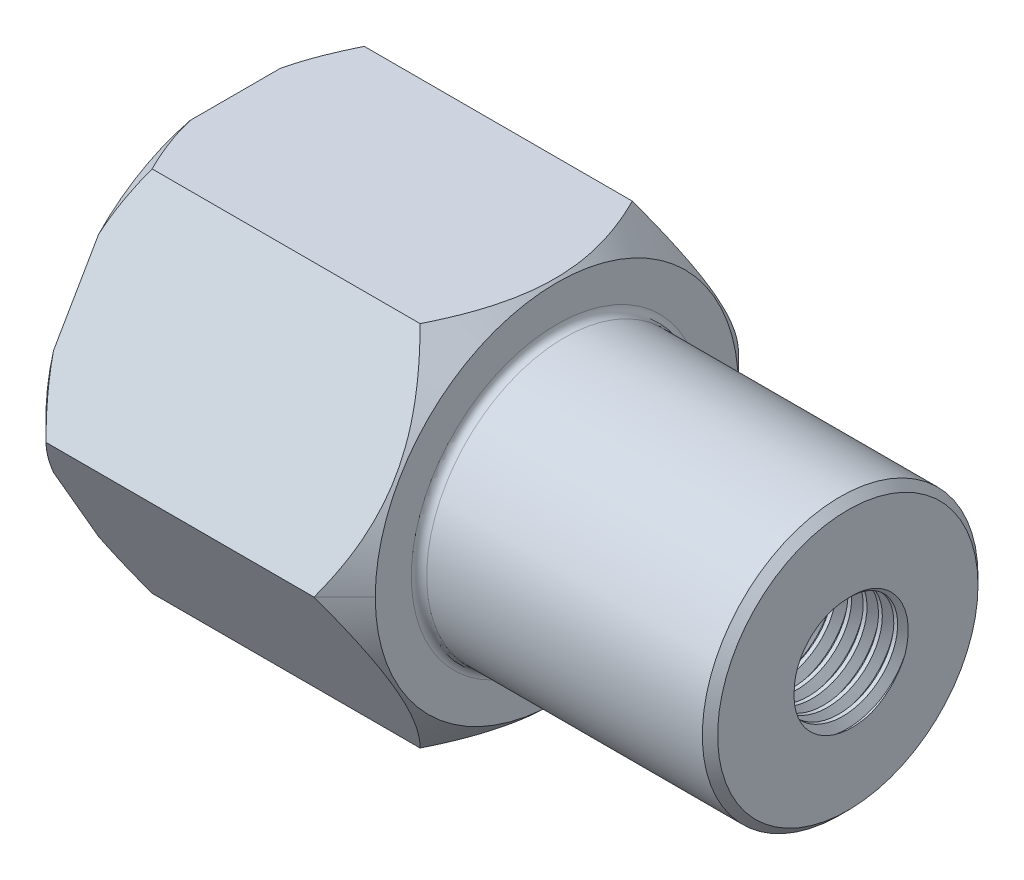
from build123d import *

# Parameters (mm, degrees)
SKETCH_1_R      = 8.5
EXTRUDE_1_DEPTH = 21
SKETCH_2_R      = 9
SKETCH_2_R_2    = 4.5
EXTRUDE_2_DEPTH = 10
THREAD_1_PITCH  = 1
FILLET_1_R      = 0.5
SKETCH_11_R     = 9
SKETCH_11_R_2   = 3.5
EXTRUDE_3_DEPTH = 9
CHAMFER_1_SIZE  = 0.5
THREAD_2_PITCH  = 1


with BuildPart() as part:
    # Sketch 1 → Бобышка-Вытянуть1 (new body)
    with BuildSketch(Plane(origin=(0, 0, 0), x_dir=(0, 0, -1), z_dir=(1, 0, 0))):
        Polygon((13.856406461, 0), (6.92820323, 12), (-6.92820323, 12), (-13.856406461, 0), (-6.92820323, -12), (6.92820323, -12), align=None)
        with Locations(Location((0, 0, 0), (0, 0, 180))):
            Circle(SKETCH_1_R, mode=Mode.SUBTRACT)
    extrude(amount=EXTRUDE_1_DEPTH)

    # Эскиз2 → Бобышка-Вытянуть2 (add)
    with BuildSketch(Plane(origin=(21, 0, 0), x_dir=(0, 0, -1), z_dir=(1, 0, 0))):
        Circle(SKETCH_2_R)
        Circle(SKETCH_2_R_2, mode=Mode.SUBTRACT)
    extrude(amount=EXTRUDE_2_DEPTH)

    # Резьба1: arcs per turn and ends read off the stored shape
    # Резьба1: the profile of Sketch 1 2 profile screwed along a right-hand helix through 14 turns, 8 arcs to a turn; built about Z, then put on its axis
    thread_1_z = Axis((0, 0, 0), (0, 0, 1))
    thread_1_corners = [(8.4997, 0, -0.000173205), (9.041265875, 0, 0.312499999), (9.041265875, 0, 0.437499999), (8.4997, 0, 0.750173202)]
    with BuildLine(mode=Mode.PRIVATE) as thread_1_profile:
        Line(thread_1_corners[0], thread_1_corners[1])
        Line(thread_1_corners[1], thread_1_corners[2])
        Line(thread_1_corners[2], thread_1_corners[3])
        Line(thread_1_corners[3], thread_1_corners[0])
    thread_1_cap = Face(thread_1_profile.wire())
    thread_1_turn_angles = [0, 22.5, 45, 67.5, 90, 112.5, 135, 157.5, 180, 202.5, 225, 247.5, 270, 292.5, 315, 337.5, 360]
    thread_1_turn_weights = [1, 0.9238795325112867, 1, 0.9238795325112867, 1, 0.9238795325112867, 1, 0.9238795325112867, 1, 0.9238795325112867, 1, 0.9238795325112867, 1, 0.9238795325112867, 1, 0.9238795325112867, 1]
    thread_1_turn_rails = [Edge.make_bspline([Vector(p[0], p[1], 0).rotate(thread_1_z, thread_1_turn_angles[k]) / thread_1_turn_weights[k] + Vector(0, 0, p[2] + THREAD_1_PITCH * thread_1_turn_angles[k] / 360) for k in range(17)], [0, 0, 0, 1, 1, 2, 2, 3, 3, 4, 4, 5, 5, 6, 6, 7, 7, 8, 8, 8], 2, thread_1_turn_weights) for p in thread_1_corners]
    thread_1_turn_sides = [Face.make_surface_from_curves(thread_1_turn_rails[p[0]], thread_1_turn_rails[p[1]]) for p in [(0, 1), (1, 2), (2, 3), (3, 0)]]
    thread_1 = Plane(origin=(-2, 0, 0), x_dir=(0, 0, -1), z_dir=(1, 0, 0)) * Solid(Shell([*[p.moved(Location((0, 0, THREAD_1_PITCH * i))) for i in range(14) for p in thread_1_turn_sides], thread_1_cap, thread_1_cap.rotate(thread_1_z, 5040).moved(Location((0, 0, THREAD_1_PITCH * 5040 / 360)))]))
    add(thread_1, mode=Mode.SUBTRACT)

    # Вырез-По траектории1: sweep along a curve in space
    with BuildLine() as sweep_1_path:
        ThreePointArc((21, 0, -9), (21, 6.363961031, -6.363961031), (21, 9, 0))
        ThreePointArc((21, 9, 0), (21, 6.363961031, 6.363961031), (21, 0, 9))
        ThreePointArc((21, 0, 9), (21, -6.363961031, 6.363961031), (21, -9, 0))
        ThreePointArc((21, -9, 0), (21, -6.363961031, -6.363961031), (21, 0, -9))
    # Эскиз8 → Вырез-По траектории1 (sweep, cut)
    with BuildSketch(Plane(origin=(0, 0, 0), x_dir=(1, 0, 0), z_dir=(0, 1, 0))):
        Polygon((21, -13.856406461), (19, -13.856406461), (21, -11.856406461), align=None)
    sweep(path=sweep_1_path.line, mode=Mode.SUBTRACT)

    # Вырез-По траектории4: sweep along a path in Эскиз10
    with BuildLine(Plane.ZY) as sweep_4_path:
        CenterArc((0, 0), 12, 0, 360)
    # Эскиз9 → Вырез-По траектории4 (sweep, cut)
    with BuildSketch(Plane(origin=(0, 0, 0), x_dir=(1, 0, 0), z_dir=(0, 1, 0))):
        Polygon((0, 13.856406461), (0, 12.356406461), (1.5, 13.856406461), align=None)
    sweep(path=sweep_4_path.line, mode=Mode.SUBTRACT)

    # Скругление1
    fillet_1_edges = [part.edges().sort_by_distance(p)[0] for p in [
        (21, 0, 9),
    ]]
    fillet(fillet_1_edges, radius=FILLET_1_R)

    # Эскиз11 → Бобышка-Вытянуть3 (add)
    with BuildSketch(Plane(origin=(31, 0, 0), x_dir=(0, 0, -1), z_dir=(1, 0, 0))):
        Circle(SKETCH_11_R)
        Circle(SKETCH_11_R_2, mode=Mode.SUBTRACT)
    extrude(amount=EXTRUDE_3_DEPTH)

    # Фаска1
    chamfer_1_edges = [part.edges().sort_by_distance(p)[0] for p in [
        (40, 0, 9),
    ]]
    chamfer(chamfer_1_edges, length=CHAMFER_1_SIZE)

    # Резьба2: arcs per turn and ends read off the stored shape
    # Резьба2: the profile of Профиль резьбы3 profile screwed along a right-hand helix through 10 turns, 8 arcs to a turn; built about Z, then put on its axis
    thread_2_z = Axis((0, 0, 0), (0, 0, 1))
    thread_2_corners = [(3.4997, 0, -0.000173205), (4.041265875, 0, 0.312499999), (4.041265875, 0, 0.437499999), (3.4997, 0, 0.750173202)]
    with BuildLine(mode=Mode.PRIVATE) as thread_2_profile:
        Line(thread_2_corners[0], thread_2_corners[1])
        Line(thread_2_corners[1], thread_2_corners[2])
        Line(thread_2_corners[2], thread_2_corners[3])
        Line(thread_2_corners[3], thread_2_corners[0])
    thread_2_cap = Face(thread_2_profile.wire())
    thread_2_turn_angles = [0, 22.5, 45, 67.5, 90, 112.5, 135, 157.5, 180, 202.5, 225, 247.5, 270, 292.5, 315, 337.5, 360]
    thread_2_turn_weights = [1, 0.9238795325112867, 1, 0.9238795325112867, 1, 0.9238795325112867, 1, 0.9238795325112867, 1, 0.9238795325112867, 1, 0.9238795325112867, 1, 0.9238795325112867, 1, 0.9238795325112867, 1]
    thread_2_turn_rails = [Edge.make_bspline([Vector(p[0], p[1], 0).rotate(thread_2_z, thread_2_turn_angles[k]) / thread_2_turn_weights[k] + Vector(0, 0, p[2] + THREAD_2_PITCH * thread_2_turn_angles[k] / 360) for k in range(17)], [0, 0, 0, 1, 1, 2, 2, 3, 3, 4, 4, 5, 5, 6, 6, 7, 7, 8, 8, 8], 2, thread_2_turn_weights) for p in thread_2_corners]
    thread_2_turn_sides = [Face.make_surface_from_curves(thread_2_turn_rails[p[0]], thread_2_turn_rails[p[1]]) for p in [(0, 1), (1, 2), (2, 3), (3, 0)]]
    thread_2 = Plane(origin=(41, 0, 0), x_dir=(0, 0, 1), z_dir=(-1, 0, 0)) * Solid(Shell([*[p.moved(Location((0, 0, THREAD_2_PITCH * i))) for i in range(10) for p in thread_2_turn_sides], thread_2_cap, thread_2_cap.rotate(thread_2_z, 3600).moved(Location((0, 0, THREAD_2_PITCH * 3600 / 360)))]))
    add(thread_2, mode=Mode.SUBTRACT)


solid = part.part
